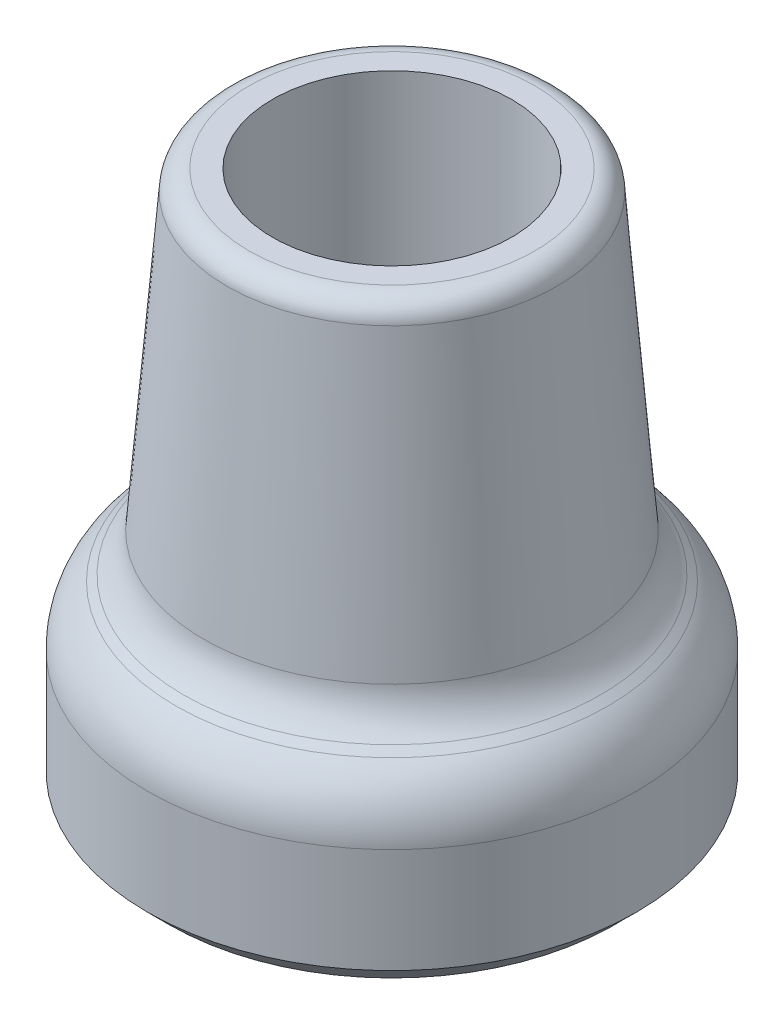
from build123d import *

# Parameters (mm, degrees)
FILLET_1_R     = 2
FILLET_2_R     = 5
FILLET_3_R     = 7
CHAMFER_1_SIZE = 2
FILLET_4_R     = 1


with BuildPart() as part:
    # Эскиз1 → Повернуть1 (revolve)
    with BuildSketch(Plane.XY):
        Polygon((0, 20), (-11, 20), (-11, 50), (-15, 50), (-17.5, 19), (-22.5, 15), (-22.5, 0), (0, 0), align=None)
    revolve(axis=Axis((0, 0, 0), (0, 1, 0)))

    # Скругление1
    fillet_1_edges = [part.edges().sort_by_distance(p)[0] for p in [
        (15, 50, 0),
    ]]
    fillet(fillet_1_edges, radius=FILLET_1_R)

    # Скругление2
    fillet_2_edges = [part.edges().sort_by_distance(p)[0] for p in [
        (17.5, 19, 0),
    ]]
    fillet(fillet_2_edges, radius=FILLET_2_R)

    # Скругление3
    fillet_3_edges = [part.edges().sort_by_distance(p)[0] for p in [
        (22.5, 15, 0),
    ]]
    fillet(fillet_3_edges, radius=FILLET_3_R)

    # Фаска1
    chamfer_1_edges = [part.edges().sort_by_distance(p)[0] for p in [
        (22.5, 0, 0),
    ]]
    chamfer(chamfer_1_edges, length=CHAMFER_1_SIZE)

    # Скругление4
    fillet_4_edges = [part.edges().sort_by_distance(p)[0] for p in [
        (11, 20, 0),
    ]]
    fillet(fillet_4_edges, radius=FILLET_4_R)


solid = part.part
